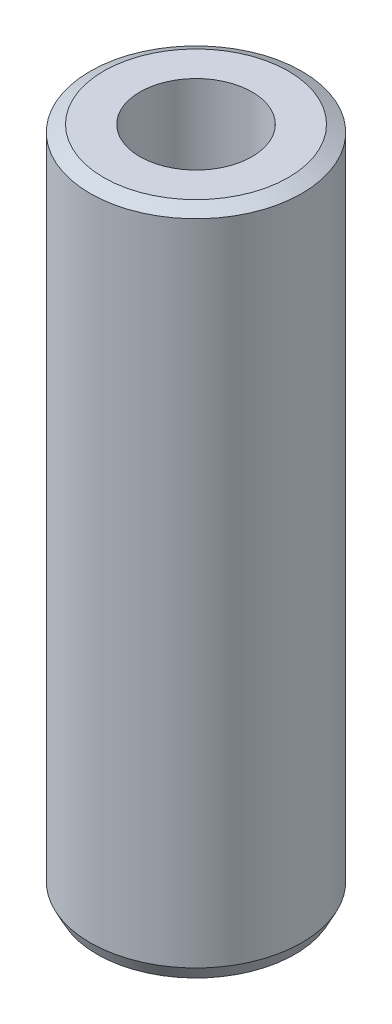
from build123d import *
from OCP.BRepFilletAPI import BRepFilletAPI_MakeChamfer

# Parameters (mm, degrees)
SKETCH1_R           = 20
BOSS_EXTRUDE1_DEPTH = 126.449340939
SKETCH2_R           = 10.596065693
CUT_EXTRUDE1_DEPTH  = 130.574055366
CHAMFER1_SIZE       = 1.312188999
CHAMFER1_SIZE2      = 2.565287356


with BuildPart() as part:
    # Sketch1 → Boss-Extrude1 (new body)
    with BuildSketch(Plane(origin=(0, 0, 0), x_dir=(1, 0, 0), z_dir=(0, 1, 0))):
        Circle(SKETCH1_R)
    extrude(amount=BOSS_EXTRUDE1_DEPTH)

    # Sketch2 → Cut-Extrude1 (cut, through all)
    with BuildSketch(Plane(origin=(0, 0, 0), x_dir=(1, 0, 0), z_dir=(0, 1, 0))):
        Circle(SKETCH2_R)
    extrude(amount=CUT_EXTRUDE1_DEPTH, mode=Mode.SUBTRACT)

    # Chamfer1: one chamfer whose edges measure the first distance from different faces: ONE call of the kernel's chamfer builder (chamfer() names one face for all edges)
    chamfer1_edges_1 = [part.edges().sort_by_distance(p)[0] for p in [
        (-20, 126.449340939, 0),
    ]]
    chamfer1_side_1 = [part.faces().sort_by_distance(p)[0] for p in [
        (-20, 63.224670469, 0),
    ]]
    chamfer1_edges_2 = [part.edges().sort_by_distance(p)[0] for p in [
        (-20, 0, 0),
    ]]
    chamfer1_side_2 = [part.faces().sort_by_distance(p)[0] for p in [
        (-19.434314575, 0, 0),
    ]]
    chamfer1 = BRepFilletAPI_MakeChamfer(part.part.solid().wrapped)
    for e in chamfer1_edges_1:
        chamfer1.Add(CHAMFER1_SIZE, CHAMFER1_SIZE2, e.wrapped, chamfer1_side_1[0].wrapped)  # the first distance lies on this face
    for e in chamfer1_edges_2:
        chamfer1.Add(CHAMFER1_SIZE, CHAMFER1_SIZE2, e.wrapped, chamfer1_side_2[0].wrapped)  # the first distance lies on this face
    add(Compound.cast(chamfer1.Shape()), mode=Mode.REPLACE)


solid = part.part
